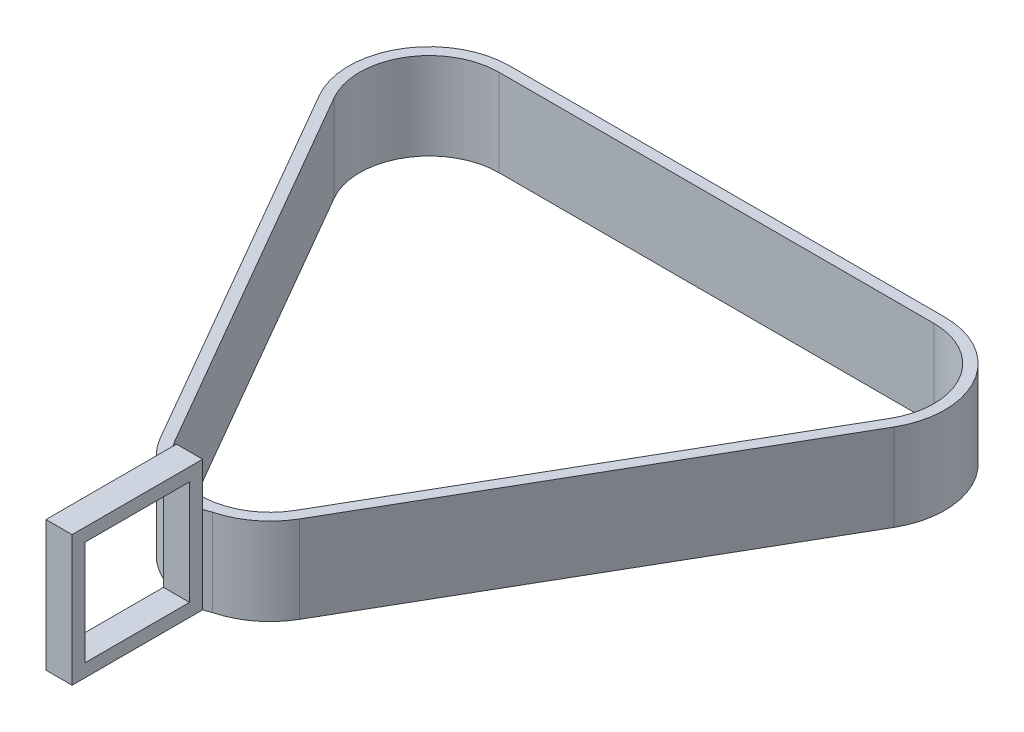
from build123d import *

# Parameters (mm, degrees)
BOSS_EXTRUDE1_DEPTH      = 20
BOSS_EXTRUDE2_DEPTH      = 3
BOSS_EXTRUDE2_DEPTH_BACK = 3
SKETCH2_W                = 30
SKETCH2_H                = 30
SKETCH2_W_2              = 24
SKETCH2_H_2              = 24
BOSS_EXTRUDE3_DEPTH      = 30
CUT_EXTRUDE1_DEPTH       = 30
CUT_EXTRUDE1_DEPTH_BACK  = 30
SKETCH4_W                = 1.682449008
SKETCH4_H                = 10


with BuildPart() as part:
    # Sketch1 → Boss-Extrude1 (new body)
    with BuildSketch(Plane(origin=(0, 0, 0), x_dir=(1, 0, 0), z_dir=(0, 1, 0))):
        with BuildLine():
            ThreePointArc((0, 18.5), (-16.02146997, 9.25), (-16.02146997, -9.25))
            Line((-16.02146997, -9.25), (33.97853003, -95.852540378))
            ThreePointArc((33.97853003, -95.852540378), (50, -105.102540378), (66.02146997, -95.852540378))
            Line((66.02146997, -95.852540378), (116.02146997, -9.25))
            ThreePointArc((116.02146997, -9.25), (116.02146997, 9.25), (100, 18.5))
            Line((100, 18.5), (0, 18.5))
        make_face()
        with BuildLine():
            ThreePointArc((-13.856406461, -8), (-13.856406461, 8), (0, 16))
            Line((0, 16), (100, 16))
            ThreePointArc((100, 16), (113.856406461, 8), (113.856406461, -8))
            Line((113.856406461, -8), (63.856406461, -94.602540378))
            ThreePointArc((63.856406461, -94.602540378), (50, -102.602540378), (36.143593539, -94.602540378))
            Line((36.143593539, -94.602540378), (-13.856406461, -8))
        make_face(mode=Mode.SUBTRACT)
    extrude(amount=BOSS_EXTRUDE1_DEPTH)



with BuildPart() as body_2:
    # Sketch2 → Boss-Extrude2 (new, two sides: drawn at the far end of the back side and taken through both)
    with BuildSketch(Plane.ZY.offset(-50).offset(-BOSS_EXTRUDE2_DEPTH_BACK)):
        with Locations((120.102540378, 15)):
            Rectangle(SKETCH2_W, SKETCH2_H)
        with Locations((120.102540378, 15)):
            Rectangle(SKETCH2_W_2, SKETCH2_H_2, mode=Mode.SUBTRACT)
    extrude(amount=BOSS_EXTRUDE2_DEPTH + BOSS_EXTRUDE2_DEPTH_BACK)


with BuildPart() as part_1:
    add(part.part)

    add(body_2.part)  # Boss-Extrude3 merges body 2
    # Sketch3 → Boss-Extrude3 (add)
    with BuildSketch(Plane(origin=(0, 30, 0), x_dir=(1, 0, 0), z_dir=(0, 1, 0))):
        Polygon((42.291564449, -103.42009137), (47, -105.102540378), (53, -105.102540378), (57.708435551, -103.42009137), align=None)
    extrude(amount=-BOSS_EXTRUDE3_DEPTH)

    # Sketch4 → Cut-Extrude1 (cut, two sides: drawn at the far end of the back side and taken through both)
    with BuildSketch(Plane.ZY.offset(-50).offset(-CUT_EXTRUDE1_DEPTH_BACK)):
        with Locations((104.261315874, 25)):
            Rectangle(SKETCH4_W, SKETCH4_H)
    extrude(amount=CUT_EXTRUDE1_DEPTH + CUT_EXTRUDE1_DEPTH_BACK, mode=Mode.SUBTRACT)


solid = part_1.part
